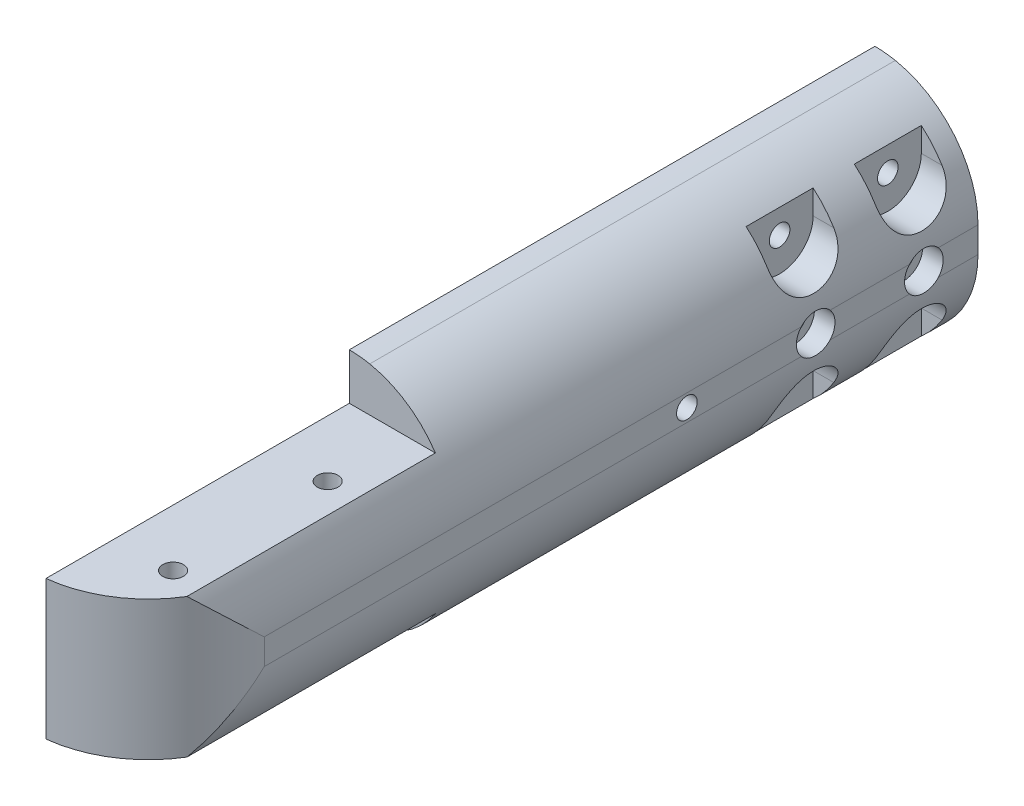
from build123d import *

# Parameters (mm, degrees)
BOSS_EXTRUDE1_DEPTH = 40
BOSS_EXTRUDE4_DEPTH = 62
BOSS_EXTRUDE5_DEPTH = 59
SKETCH6_R           = 2
CUT_EXTRUDE1_DEPTH  = 167.502702677
CUT_EXTRUDE3_DEPTH  = 165.114099029
CUT_EXTRUDE2_DEPTH  = 167.213605035
SKETCH9_R           = 2
CUT_EXTRUDE4_DEPTH  = 164.653126563
SKETCH10_R          = 3.75
CUT_EXTRUDE5_DEPTH  = 4
CUT_EXTRUDE6_DEPTH  = 7
SHELL7_START        = 45
SHELL7_DEPTH        = 52
SHELL7_START_2      = 124.2000001
SHELL7_2_DEPTH      = 14.2999998
SHELL7_START_3      = 97
SHELL7_3_DEPTH      = 13.1999999
SHELL7_START_4      = -8.5
SHELL7_4_DEPTH      = 17
SHELL7_START_5      = 110.199999903
SHELL7_5_DEPTH      = 31.800000097
SKETCH13_R          = 10
CUT_EXTRUDE7_DEPTH  = 10
BOSS_EXTRUDE6_REACH = 165.653


with BuildPart() as part:
    # Sketch1 → Boss-Extrude1 (new body)
    with BuildSketch(Plane.XY):
        with BuildLine():
            ThreePointArc((0.25, -22.498611068), (22.5, 0), (0.25, 22.498611068))
            Line((0.25, 22.498611068), (0.25, 9.996874512))
            ThreePointArc((0.25, 9.996874512), (10, 0), (0.25, -9.996874512))
            Line((0.25, -9.996874512), (0.25, -22.498611068))
        make_face()
    extrude(amount=BOSS_EXTRUDE1_DEPTH)

    # Sketch5 → Boss-Extrude4 (add)
    with BuildSketch(Plane.XY.offset(40)):
        with BuildLine():
            ThreePointArc((0.25, -22.498611068), (22.5, 0), (0.25, 22.498611068))
            Line((0.25, 22.498611068), (0.25, -22.498611068))
        make_face()
    extrude(amount=BOSS_EXTRUDE4_DEPTH)

    # Sketch3 → Boss-Extrude5 (add)
    with BuildSketch(Plane.XY.offset(102)):
        with BuildLine():
            ThreePointArc((18, -13.5), (22.5, 0), (18, 13.5))
            Line((18, 13.5), (0.25, 13.5))
            Line((0.25, 13.5), (0.25, -13.5))
            Line((0.25, -13.5), (18, -13.5))
        make_face()
    extrude(amount=BOSS_EXTRUDE5_DEPTH)

    # Sketch6 → Cut-Extrude1 (cut, through all)
    with BuildSketch(Plane.XZ.offset(13.5)):
        with Locations(Location((11.245, 117.2, 0), (0, 0, 270))):
            Circle(SKETCH6_R)
        with Locations(Location((11.245, 147.2, 0), (0, 0, 270))):
            Circle(SKETCH6_R)
    extrude(amount=-CUT_EXTRUDE1_DEPTH, mode=Mode.SUBTRACT)

    # Sketch8 → Cut-Extrude3 (cut, through all)
    with BuildSketch(Plane(origin=(0, 0, 0), x_dir=(-1, 0, 0), z_dir=(0, 0, -1))):
        with BuildLine():
            Line((-20.25, -2.498611068), (-20.25, 2.498611068))
            ThreePointArc((-20.25, 2.498611068), (-15.729842997, 15.162514921), (-4.21255392, 22.102135405))
            ThreePointArc((-4.21255392, 22.102135405), (-22.5, 0), (-4.21255392, -22.102135405))
            ThreePointArc((-4.21255392, -22.102135405), (-15.729842997, -15.162514921), (-20.25, -2.498611068))
        make_face()
    extrude(amount=-CUT_EXTRUDE3_DEPTH, mode=Mode.SUBTRACT)

    # Sketch7 → Cut-Extrude2 (cut, through all)
    with BuildSketch(Plane.XZ.offset(13.5)):
        with BuildLine():
            Line((20.25, 138.5), (20.25, 161))
            Line((20.25, 161), (-2.25, 161))
            ThreePointArc((-2.25, 161), (13.659902577, 154.409902577), (20.25, 138.5))
        make_face()
    extrude(amount=-CUT_EXTRUDE2_DEPTH, mode=Mode.SUBTRACT)

    # Sketch9 → Cut-Extrude4 (cut, through all)
    with BuildSketch(Plane.ZY.offset(-0.25)):
        with Locations(Location((31.5, -13, 0), (0, 0, 270))):
            Circle(SKETCH9_R)
        with Locations(Location((10.5, -13, 0), (0, 0, 270))):
            Circle(SKETCH9_R)
        with Locations(Location((10.5, 13, 0), (0, 0, 270))):
            Circle(SKETCH9_R)
        with Locations(Location((31.5, 13, 0), (0, 0, 270))):
            Circle(SKETCH9_R)
        with Locations(Location((56.5, 0, 0), (0, 0, 270))):
            Circle(SKETCH9_R)
        with Locations(Location((31.5, 0, 0), (0, 0, 270))):
            Circle(SKETCH9_R)
        with Locations(Location((10.5, 0, 0), (0, 0, 270))):
            Circle(SKETCH9_R)
    extrude(amount=-CUT_EXTRUDE4_DEPTH, mode=Mode.SUBTRACT)

    # Sketch10 → Cut-Extrude5 (cut)
    with BuildSketch(Plane(origin=(20.25, 0, 0), x_dir=(0, 0, -1), z_dir=(1, 0, 0))):
        with Locations((-31.5, 0)):
            Circle(SKETCH10_R)
        with Locations((-10.5, 0)):
            Circle(SKETCH10_R)
    extrude(amount=-CUT_EXTRUDE5_DEPTH, mode=Mode.SUBTRACT)

    # Sketch11 → Cut-Extrude6 (cut)
    with BuildSketch(Plane(origin=(20.25, 0, 0), x_dir=(0, 0, -1), z_dir=(1, 0, 0))):
        with BuildLine():
            Line((-4, -13), (-4, -19.5))
            Line((-4, -19.5), (-17, -19.5))
            Line((-17, -19.5), (-17, -13))
            ThreePointArc((-17, -13), (-10.5, -6.5), (-4, -13))
        make_face()
        with BuildLine():
            Line((-25, -13), (-25, -19.5))
            Line((-25, -19.5), (-38, -19.5))
            Line((-38, -19.5), (-38, -13))
            ThreePointArc((-38, -13), (-31.5, -6.5), (-25, -13))
        make_face()
        with BuildLine():
            Line((-38, 19.5), (-38, 13))
            ThreePointArc((-38, 13), (-31.5, 6.5), (-25, 13))
            Line((-25, 13), (-25, 19.5))
            Line((-25, 19.5), (-38, 19.5))
        make_face()
        with BuildLine():
            Line((-17, 19.5), (-17, 13))
            ThreePointArc((-17, 13), (-10.5, 6.5), (-4, 13))
            Line((-4, 13), (-4, 19.5))
            Line((-4, 19.5), (-17, 19.5))
        make_face()
    extrude(amount=-CUT_EXTRUDE6_DEPTH, mode=Mode.SUBTRACT)


with BuildPart() as body_2:
    # Split1: the piece on the far side of the plane
    add(part.part)
    split(bisect_by=Plane(origin=(0, 0, 40), x_dir=(-1, 0, 0), z_dir=(0, 0, -1)), keep=Keep.BOTTOM)

    # Shell7: read off the stored shape, not the designer's step
    # Shell7 outline → Shell7 (cut)
    with BuildSketch(Plane.XY.offset(SHELL7_START)):
        with BuildLine():
            ThreePointArc((13.997120822, -8.5), (14.933439861, -5.563997477), (15.25, -2.498611068))
            Line((15.25, -2.498611068), (15.25, 2.498611068))
            ThreePointArc((15.25, 2.498611068), (14.933439861, 5.563997477), (13.997120822, 8.5))
            ThreePointArc((13.997120822, 8.5), (9.684583044, 14.160027911), (3.248890974, 17.19577586))
            ThreePointArc((3.248890974, 17.19577586), (1.755968892, 17.41167922), (0.25, 17.498214195))
            Line((0.25, 17.498214195), (0.25, -17.498214195))
            ThreePointArc((0.25, -17.498214195), (1.755968892, -17.41167922), (3.248890974, -17.19577586))
            ThreePointArc((3.248890974, -17.19577586), (9.684583044, -14.160027911), (13.997120822, -8.5))
        make_face()
    extrude(amount=SHELL7_DEPTH, mode=Mode.SUBTRACT)

    # Shell7 2 outline → Shell7 2 (cut)
    with BuildSketch(Plane.XY.offset(SHELL7_START_2)):
        with BuildLine():
            ThreePointArc((13.997120822, -8.5), (14.933439861, -5.563997477), (15.25, -2.498611068))
            Line((15.25, -2.498611068), (15.25, 2.498611068))
            ThreePointArc((15.25, 2.498611068), (14.933439861, 5.563997477), (13.997120822, 8.5))
            Line((13.997120822, 8.5), (0.25, 8.5))
            Line((0.25, 8.5), (0.25, -8.5))
            Line((0.25, -8.5), (13.997120822, -8.5))
        make_face()
    extrude(amount=SHELL7_2_DEPTH, mode=Mode.SUBTRACT)

    # Shell7 3 outline → Shell7 3 (cut)
    with BuildSketch(Plane.XY.offset(SHELL7_START_3)):
        with BuildLine():
            ThreePointArc((13.997120822, -8.5), (14.933439861, -5.563997477), (15.25, -2.498611068))
            Line((15.25, -2.498611068), (15.25, 2.498611068))
            ThreePointArc((15.25, 2.498611068), (14.933439861, 5.563997477), (13.997120822, 8.5))
            Line((13.997120822, 8.5), (0.25, 8.5))
            Line((0.25, 8.5), (0.25, -8.5))
            Line((0.25, -8.5), (13.997120822, -8.5))
        make_face()
    extrude(amount=SHELL7_3_DEPTH, mode=Mode.SUBTRACT)

    # Shell7 4 outline → Shell7 4 (cut)
    with BuildSketch(Plane(origin=(0, 0, 0), x_dir=(1, 0, 0), z_dir=(0, 1, 0)).offset(SHELL7_START_4)):
        with BuildLine():
            Line((15.25, -110.1999999), (11.245, -110.2))
            ThreePointArc((11.245, -110.2), (13.344101595, -110.522143121), (15.250000007, -111.458922144))
            Line((15.250000007, -111.458922144), (15.25, -110.1999999))
        make_face()
        with BuildLine():
            ThreePointArc((15.023363678, -141.307295365), (15.1932489, -139.908214409), (15.25, -138.5))
            Line((15.25, -138.5), (0.25, -138.4999999))
            Line((0.25, -138.4999999), (0.25, -155.820508076))
            ThreePointArc((0.25, -155.820508076), (3.996611658, -154.847166201), (7.437583117, -153.073974521))
            ThreePointArc((7.437583117, -153.073974521), (5.361642488, -143.407098158), (15.023363678, -141.307295365))
        make_face()
        with BuildLine():
            Line((11.245, -124.2), (15.25, -124.2000001))
            Line((15.25, -124.2000001), (15.250000007, -122.941077856))
            ThreePointArc((15.250000007, -122.941077856), (13.344101595, -123.877856879), (11.245, -124.2))
        make_face()
        with BuildLine():
            Line((0.25, -110.1999999), (0.25, -124.2000001))
            Line((0.25, -124.2000001), (11.245, -124.2))
            ThreePointArc((11.245, -124.2), (4.245, -117.2), (11.245, -110.2))
            Line((11.245, -110.2), (0.25, -110.1999999))
        make_face()
    extrude(amount=SHELL7_4_DEPTH, mode=Mode.SUBTRACT)

    # Shell7 5 outline → Shell7 5 (add)
    with BuildSketch(Plane.XY.offset(SHELL7_START_5)):
        with BuildLine():
            Line((15.250000007, 8.5), (13.997120822, 8.5))
            ThreePointArc((13.997120822, 8.5), (14.933439861, 5.563997477), (15.25, 2.498611068))
            Line((15.25, 2.498611068), (15.250000007, 8.5))
        make_face()
        with BuildLine():
            Line((15.250000001, -8.5), (15.25, -2.498611068))
            ThreePointArc((15.25, -2.498611068), (14.933439861, -5.563997477), (13.997120822, -8.5))
            Line((13.997120822, -8.5), (15.250000001, -8.5))
        make_face()
    extrude(amount=SHELL7_5_DEPTH)

    # Sketch13 → Cut-Extrude7 (cut)
    with BuildSketch(Plane(origin=(0, 0, 40), x_dir=(-1, 0, 0), z_dir=(0, 0, -1))):
        Circle(SKETCH13_R)
    extrude(amount=-CUT_EXTRUDE7_DEPTH, mode=Mode.SUBTRACT)


with BuildPart() as part_1:
    add(part.part)

    # Split1
    split(bisect_by=Plane(origin=(0, 0, 40), x_dir=(-1, 0, 0), z_dir=(0, 0, -1)), keep=Keep.TOP)

    # Combine1: union body 2
    add(body_2.part)

    # Sketch14 → Boss-Extrude6 (add, up to next)
    with BuildSketch(Plane.ZY.offset(-0.25), mode=Mode.PRIVATE) as boss_extrude6_sk1:
        Polygon((67.417934948, 0), (45, -15.087454904), (45, -17.498214195), (48.582065052, -17.498214195), (71, -2.41075929), (93.417934948, -17.498214195), (97, -17.498214195), (97, -15.087454904), (74.582065052, 0), (97, 15.087454904), (97, 17.498214195), (93.417934948, 17.498214195), (71, 2.41075929), (48.582065052, 17.498214195), (45, 17.498214195), (45, 15.087454904), align=None)
    boss_extrude6_tool1 = extrude(boss_extrude6_sk1.sketch, amount=-BOSS_EXTRUDE6_REACH, mode=Mode.PRIVATE) - part_1.part
    add(boss_extrude6_tool1.solids().sort_by_distance((0.25, 0, 71))[0])


solid = part_1.part
